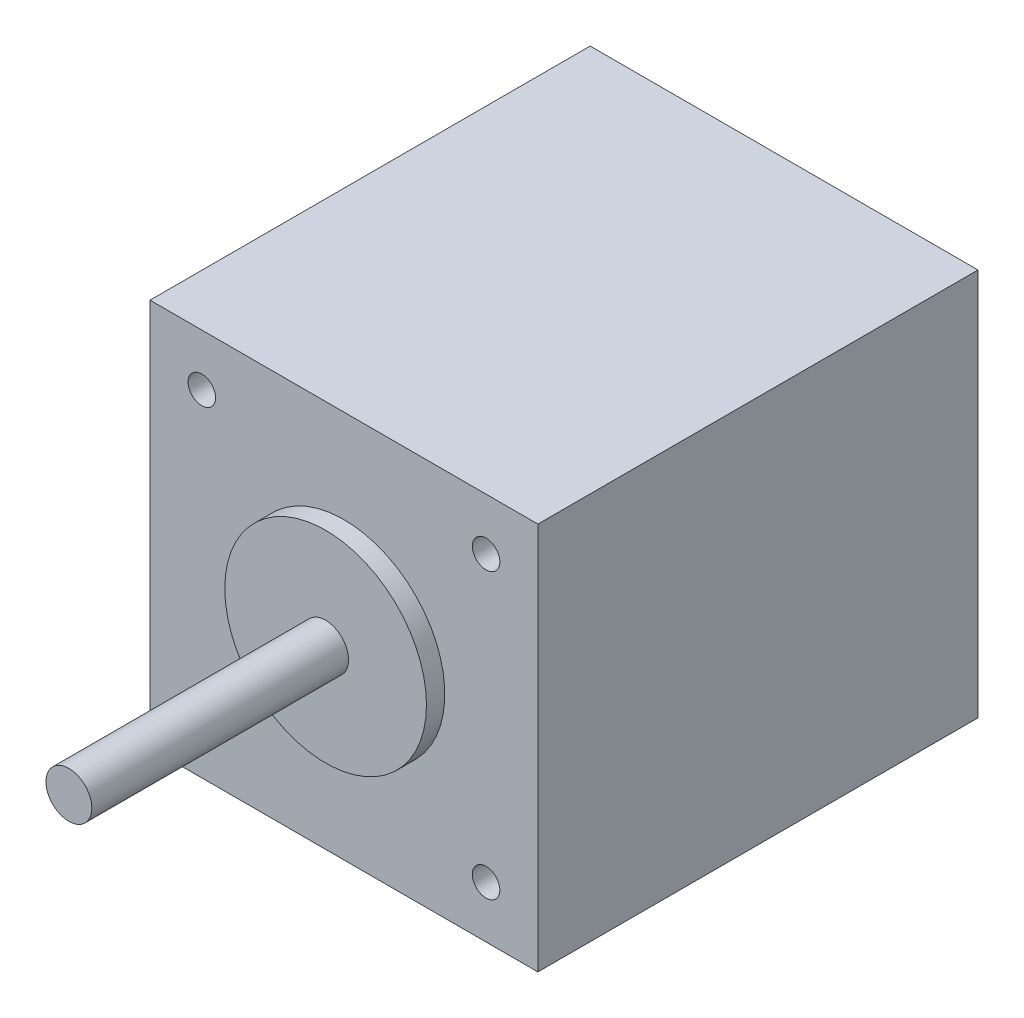
from build123d import *

# Parameters (mm, degrees)
SKETCH_1_W          = 42.3
SKETCH_1_H          = 42.3
EXTRUDE_1188_DEPTH  = 48
SKETCH_2_R          = 2.5
EXTRUDE_1243_DEPTH  = 78
SKETCH_3_R          = 11
EXTRUDE_1290_DEPTH  = 50
CUT_EXTRUDE_START   = 48
SKETCH_5_R          = 1.5
CUT_EXTRUDE_3_DEPTH = 4.5


with BuildPart() as part:
    # Эскиз1 → Extrude 1188 (new body)
    with BuildSketch(Plane.XY):
        Rectangle(SKETCH_1_W, SKETCH_1_H)
    extrude(amount=EXTRUDE_1188_DEPTH)

    # Эскиз2 → Extrude 1243 (add)
    with BuildSketch(Plane.XY):
        Circle(SKETCH_2_R)
    extrude(amount=EXTRUDE_1243_DEPTH)

    # Эскиз3 → Extrude 1290 (add)
    with BuildSketch(Plane.XY):
        Circle(SKETCH_3_R)
    extrude(amount=EXTRUDE_1290_DEPTH)

    # Эскиз5 → Крепеж_М3_ПРЕДВ (cut)
    with BuildSketch(Plane.XY.offset(CUT_EXTRUDE_START)):
        with Locations((-15.5, -15.5)):
            Circle(SKETCH_5_R)
        with Locations((-15.5, 15.5)):
            Circle(SKETCH_5_R)
        with Locations((15.5, -15.5)):
            Circle(SKETCH_5_R)
        with Locations((15.5, 15.5)):
            Circle(SKETCH_5_R)
    extrude(amount=-CUT_EXTRUDE_3_DEPTH, mode=Mode.SUBTRACT)


solid = part.part
